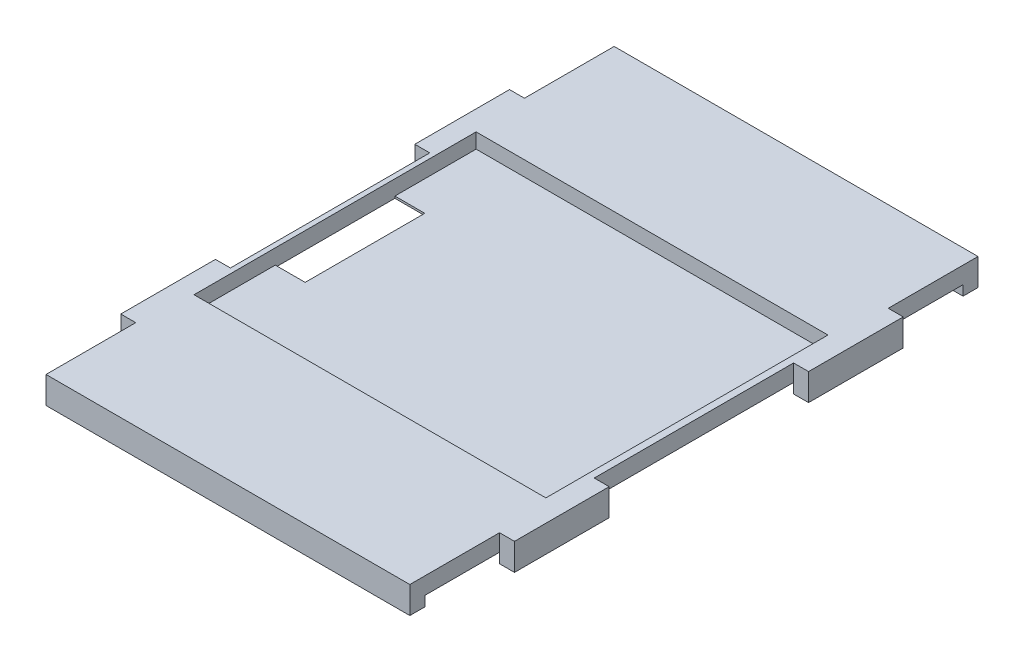
from build123d import *

# Parameters (mm, degrees)
SKETCH3_W           = 39.5
SKETCH3_H           = 57
SKETCH3_W_2         = 36.5
SKETCH3_H_2         = 54
BOSS_EXTRUDE1_DEPTH = 1
SKETCH4_W           = 39.5
SKETCH4_H           = 57
BOSS_EXTRUDE2_DEPTH = 1.7
SKETCH6_W           = 35.3
SKETCH6_H           = 28.3
CUT_EXTRUDE1_DEPTH  = 1.5
SKETCH7_W           = 1.5
SKETCH7_H           = 9
SKETCH7_H_2         = 20
CUT_EXTRUDE2_DEPTH  = 4
SKETCH9_W           = 3
SKETCH9_H           = 12
CUT_EXTRUDE3_DEPTH  = 7


with BuildPart() as part:
    # Sketch3 → Boss-Extrude1 (new body)
    with BuildSketch(Plane(origin=(0, 0, 0), x_dir=(1, 0, 0), z_dir=(0, 1, 0))):
        with Locations((19.75, 28.5)):
            Rectangle(SKETCH3_W, SKETCH3_H)
        with Locations((19.75, 28.5)):
            Rectangle(SKETCH3_W_2, SKETCH3_H_2, mode=Mode.SUBTRACT)
    extrude(amount=BOSS_EXTRUDE1_DEPTH)

    # Sketch4 → Boss-Extrude2 (add)
    with BuildSketch(Plane(origin=(0, 1, 0), x_dir=(1, 0, 0), z_dir=(0, 1, 0))):
        with Locations((19.75, 28.5)):
            Rectangle(SKETCH4_W, SKETCH4_H)
    extrude(amount=BOSS_EXTRUDE2_DEPTH)

    # Sketch6 → Cut-Extrude1 (cut)
    with BuildSketch(Plane(origin=(0, 2.7, 0), x_dir=(1, 0, 0), z_dir=(0, 1, 0))):
        with Locations((19.65, 28.5)):
            Rectangle(SKETCH6_W, SKETCH6_H)
    extrude(amount=-CUT_EXTRUDE1_DEPTH, mode=Mode.SUBTRACT)

    # Sketch7 → Cut-Extrude2 (cut)
    with BuildSketch(Plane(origin=(0, 2.7, 0), x_dir=(1, 0, 0), z_dir=(0, 1, 0))):
        with Locations((0.75, 52.5)):
            Rectangle(SKETCH7_W, SKETCH7_H)
        with Locations((0.75, 28.5)):
            Rectangle(SKETCH7_W, SKETCH7_H_2)
        with Locations((0.75, 4.5)):
            Rectangle(SKETCH7_W, SKETCH7_H)
        with Locations((38.75, 52.5)):
            Rectangle(SKETCH7_W, SKETCH7_H)
        with Locations((38.75, 28.5)):
            Rectangle(SKETCH7_W, SKETCH7_H_2)
        with Locations((38.75, 4.5)):
            Rectangle(SKETCH7_W, SKETCH7_H)
    extrude(amount=-CUT_EXTRUDE2_DEPTH, mode=Mode.SUBTRACT)

    # Sketch9 → Cut-Extrude3 (cut)
    with BuildSketch(Plane(origin=(0, 1.2, 0), x_dir=(1, 0, 0), z_dir=(0, 1, 0))):
        with Locations((3.5, 28.5)):
            Rectangle(SKETCH9_W, SKETCH9_H)
    extrude(amount=-CUT_EXTRUDE3_DEPTH, mode=Mode.SUBTRACT)


solid = part.part
